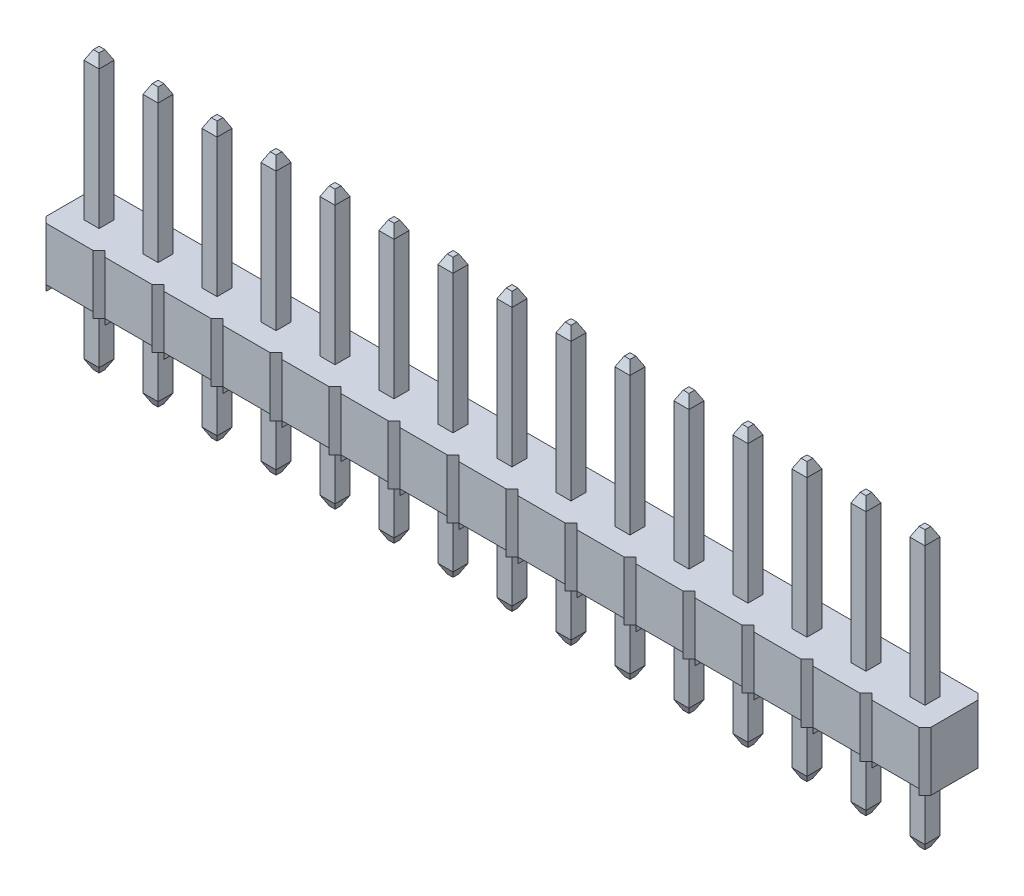
from build123d import *
from OCP.BRepFilletAPI import BRepFilletAPI_MakeChamfer

# Parameters (mm, degrees)
BOSS_EXTRUDE1_START  = -2.286
BOSS_EXTRUDE1_DEPTH  = 2.54
SKETCH2_W            = 2.032
SKETCH2_H            = 2.54
CUT_EXTRUDE1_DEPTH   = 0.254
SKETCH3_W            = 2.032
SKETCH3_H            = 2.54
CUT_EXTRUDE2_DEPTH   = 0.254
SKETCH4_W            = 2.032
SKETCH4_H            = 2.54
CUT_EXTRUDE3_DEPTH   = 0.254
SKETCH5_W            = 2.032
SKETCH5_H            = 2.54
CUT_EXTRUDE4_DEPTH   = 0.254
SKETCH6_W            = 2.032
SKETCH6_H            = 2.54
CUT_EXTRUDE5_DEPTH   = 0.254
SKETCH7_W            = 2.032
SKETCH7_H            = 2.54
CUT_EXTRUDE6_DEPTH   = 0.254
SKETCH8_W            = 2.032
SKETCH8_H            = 2.54
CUT_EXTRUDE7_DEPTH   = 0.254
SKETCH9_W            = 2.032
SKETCH9_H            = 2.54
CUT_EXTRUDE8_DEPTH   = 0.254
SKETCH10_W           = 2.032
SKETCH10_H           = 2.54
CUT_EXTRUDE9_DEPTH   = 0.254
SKETCH11_W           = 2.032
SKETCH11_H           = 2.54
CUT_EXTRUDE10_DEPTH  = 0.254
SKETCH12_W           = 2.032
SKETCH12_H           = 2.54
CUT_EXTRUDE11_DEPTH  = 0.254
SKETCH13_W           = 2.032
SKETCH13_H           = 2.54
CUT_EXTRUDE12_DEPTH  = 0.254
SKETCH14_W           = 2.032
SKETCH14_H           = 2.54
CUT_EXTRUDE13_DEPTH  = 0.254
CUT_EXTRUDE14_DEPTH  = 0.254
CUT_EXTRUDE15_DEPTH  = 0.254
BOSS_EXTRUDE2_DEPTH  = 0.254
BOSS_EXTRUDE3_DEPTH  = 0.254
SKETCH19_W           = 0.65
SKETCH19_H           = 0.65
BOSS_EXTRUDE4_DEPTH  = 3.302
SKETCH20_W           = 0.65
SKETCH20_H           = 0.65
BOSS_EXTRUDE5_DEPTH  = 3.302
SKETCH21_W           = 0.65
SKETCH21_H           = 0.65
BOSS_EXTRUDE6_DEPTH  = 3.302
SKETCH22_W           = 0.65
SKETCH22_H           = 0.65
BOSS_EXTRUDE7_DEPTH  = 3.302
SKETCH23_W           = 0.65
SKETCH23_H           = 0.65
BOSS_EXTRUDE8_DEPTH  = 3.302
SKETCH24_W           = 0.65
SKETCH24_H           = 0.65
BOSS_EXTRUDE9_DEPTH  = 3.302
SKETCH25_W           = 0.65
SKETCH25_H           = 0.65
BOSS_EXTRUDE10_DEPTH = 3.302
SKETCH26_W           = 0.65
SKETCH26_H           = 0.65
BOSS_EXTRUDE11_DEPTH = 3.302
SKETCH27_W           = 0.65
SKETCH27_H           = 0.65
BOSS_EXTRUDE12_DEPTH = 3.302
SKETCH28_W           = 0.65
SKETCH28_H           = 0.65
BOSS_EXTRUDE13_DEPTH = 3.302
SKETCH29_W           = 0.65
SKETCH29_H           = 0.65
BOSS_EXTRUDE14_DEPTH = 3.302
SKETCH30_W           = 0.65
SKETCH30_H           = 0.65
BOSS_EXTRUDE15_DEPTH = 3.302
SKETCH31_W           = 0.65
SKETCH31_H           = 0.65
BOSS_EXTRUDE16_DEPTH = 3.302
SKETCH32_W           = 0.65
SKETCH32_H           = 0.65
BOSS_EXTRUDE17_DEPTH = 3.302
SKETCH33_W           = 0.65
SKETCH33_H           = 0.65
BOSS_EXTRUDE18_DEPTH = 3.302
SKETCH34_W           = 0.65
SKETCH34_H           = 0.65
BOSS_EXTRUDE19_DEPTH = 6.35
SKETCH35_W           = 0.65
SKETCH35_H           = 0.65
BOSS_EXTRUDE20_DEPTH = 6.35
SKETCH36_W           = 0.65
SKETCH36_H           = 0.65
BOSS_EXTRUDE21_DEPTH = 6.35
SKETCH37_W           = 0.65
SKETCH37_H           = 0.65
BOSS_EXTRUDE22_DEPTH = 6.35
SKETCH38_W           = 0.65
SKETCH38_H           = 0.65
BOSS_EXTRUDE23_DEPTH = 6.35
SKETCH39_W           = 0.65
SKETCH39_H           = 0.65
BOSS_EXTRUDE24_DEPTH = 6.35
SKETCH40_W           = 0.65
SKETCH40_H           = 0.65
BOSS_EXTRUDE25_DEPTH = 6.35
SKETCH41_W           = 0.65
SKETCH41_H           = 0.65
BOSS_EXTRUDE26_DEPTH = 6.35
SKETCH42_W           = 0.65
SKETCH42_H           = 0.65
BOSS_EXTRUDE27_DEPTH = 6.35
SKETCH43_W           = 0.65
SKETCH43_H           = 0.65
BOSS_EXTRUDE28_DEPTH = 6.35
SKETCH44_W           = 0.65
SKETCH44_H           = 0.65
BOSS_EXTRUDE29_DEPTH = 6.35
SKETCH45_W           = 0.65
SKETCH45_H           = 0.65
BOSS_EXTRUDE30_DEPTH = 6.35
SKETCH46_W           = 0.65
SKETCH46_H           = 0.65
BOSS_EXTRUDE31_DEPTH = 6.35
SKETCH47_W           = 0.65
SKETCH47_H           = 0.65
BOSS_EXTRUDE32_DEPTH = 6.35
SKETCH48_W           = 0.65
SKETCH48_H           = 0.65
BOSS_EXTRUDE33_DEPTH = 6.35
CHAMFER1_SIZE        = 0.254
CHAMFER2_SIZE        = 0.2
CHAMFER2_SIZE2       = 0.4


with BuildPart() as part:
    # Boss-Extrude1: read off the stored shape, not the designer's step
    # Boss-Extrude1 outline → Boss-Extrude1 (new body)
    with BuildSketch(Plane.XZ.offset(-0.254).offset(BOSS_EXTRUDE1_START)):
        Polygon((31.496, -1.27), (31.75, -1.016), (32.004, -1.27), (34.036, -1.27), (34.29, -1.016), (34.544, -1.27), (36.576, -1.27), (36.83, -1.016), (36.83, 1.27), (34.544, 1.27), (34.29, 1.016), (34.036, 1.27), (32.004, 1.27), (31.75, 1.016), (31.496, 1.27), (29.464, 1.27), (29.21, 1.016), (28.956, 1.27), (26.924, 1.27), (26.67, 1.016), (26.416, 1.27), (24.384, 1.27), (24.13, 1.016), (23.876, 1.27), (21.844, 1.27), (21.59, 1.016), (21.336, 1.27), (19.304, 1.27), (19.05, 1.016), (18.796, 1.27), (16.764, 1.27), (16.51, 1.016), (16.256, 1.27), (14.224, 1.27), (13.97, 1.016), (13.716, 1.27), (11.684, 1.27), (11.43, 1.016), (11.176, 1.27), (9.144, 1.27), (8.89, 1.016), (8.636, 1.27), (6.604, 1.27), (6.35, 1.016), (6.096, 1.27), (4.064, 1.27), (3.81, 1.016), (3.556, 1.27), (1.524, 1.27), (1.27, 1.016), (1.016, 1.27), (-1.016, 1.27), (-1.27, 1.016), (-1.27, -1.27), (1.016, -1.27), (1.27, -1.016), (1.524, -1.27), (3.556, -1.27), (3.81, -1.016), (4.064, -1.27), (6.096, -1.27), (6.35, -1.016), (6.604, -1.27), (8.636, -1.27), (8.89, -1.016), (9.144, -1.27), (11.176, -1.27), (11.43, -1.016), (11.684, -1.27), (13.716, -1.27), (13.97, -1.016), (14.224, -1.27), (16.256, -1.27), (16.51, -1.016), (16.764, -1.27), (18.796, -1.27), (19.05, -1.016), (19.304, -1.27), (21.336, -1.27), (21.59, -1.016), (21.844, -1.27), (23.876, -1.27), (24.13, -1.016), (24.384, -1.27), (26.416, -1.27), (26.67, -1.016), (26.924, -1.27), (28.956, -1.27), (29.21, -1.016), (29.464, -1.27), align=None)
    extrude(amount=BOSS_EXTRUDE1_DEPTH)

    # Sketch2 → Cut-Extrude1 (cut)
    with BuildSketch(Plane.XZ):
        with Locations((17.78, 0)):
            Rectangle(SKETCH2_W, SKETCH2_H)
    extrude(amount=-CUT_EXTRUDE1_DEPTH, mode=Mode.SUBTRACT)

    # Sketch3 → Cut-Extrude2 (cut)
    with BuildSketch(Plane.XZ):
        with Locations((15.24, 0)):
            Rectangle(SKETCH3_W, SKETCH3_H)
    extrude(amount=-CUT_EXTRUDE2_DEPTH, mode=Mode.SUBTRACT)

    # Sketch4 → Cut-Extrude3 (cut)
    with BuildSketch(Plane.XZ):
        with Locations((20.32, 0)):
            Rectangle(SKETCH4_W, SKETCH4_H)
    extrude(amount=-CUT_EXTRUDE3_DEPTH, mode=Mode.SUBTRACT)

    # Sketch5 → Cut-Extrude4 (cut)
    with BuildSketch(Plane.XZ):
        with Locations((12.7, 0)):
            Rectangle(SKETCH5_W, SKETCH5_H)
    extrude(amount=-CUT_EXTRUDE4_DEPTH, mode=Mode.SUBTRACT)

    # Sketch6 → Cut-Extrude5 (cut)
    with BuildSketch(Plane.XZ):
        with Locations((22.86, 0)):
            Rectangle(SKETCH6_W, SKETCH6_H)
    extrude(amount=-CUT_EXTRUDE5_DEPTH, mode=Mode.SUBTRACT)

    # Sketch7 → Cut-Extrude6 (cut)
    with BuildSketch(Plane.XZ):
        with Locations((10.16, 0)):
            Rectangle(SKETCH7_W, SKETCH7_H)
    extrude(amount=-CUT_EXTRUDE6_DEPTH, mode=Mode.SUBTRACT)

    # Sketch8 → Cut-Extrude7 (cut)
    with BuildSketch(Plane.XZ):
        with Locations((25.4, 0)):
            Rectangle(SKETCH8_W, SKETCH8_H)
    extrude(amount=-CUT_EXTRUDE7_DEPTH, mode=Mode.SUBTRACT)

    # Sketch9 → Cut-Extrude8 (cut)
    with BuildSketch(Plane.XZ):
        with Locations((7.62, 0)):
            Rectangle(SKETCH9_W, SKETCH9_H)
    extrude(amount=-CUT_EXTRUDE8_DEPTH, mode=Mode.SUBTRACT)

    # Sketch10 → Cut-Extrude9 (cut)
    with BuildSketch(Plane.XZ):
        with Locations((27.94, 0)):
            Rectangle(SKETCH10_W, SKETCH10_H)
    extrude(amount=-CUT_EXTRUDE9_DEPTH, mode=Mode.SUBTRACT)

    # Sketch11 → Cut-Extrude10 (cut)
    with BuildSketch(Plane.XZ):
        with Locations((5.08, 0)):
            Rectangle(SKETCH11_W, SKETCH11_H)
    extrude(amount=-CUT_EXTRUDE10_DEPTH, mode=Mode.SUBTRACT)

    # Sketch12 → Cut-Extrude11 (cut)
    with BuildSketch(Plane.XZ):
        with Locations((30.48, 0)):
            Rectangle(SKETCH12_W, SKETCH12_H)
    extrude(amount=-CUT_EXTRUDE11_DEPTH, mode=Mode.SUBTRACT)

    # Sketch13 → Cut-Extrude12 (cut)
    with BuildSketch(Plane.XZ):
        with Locations((2.54, 0)):
            Rectangle(SKETCH13_W, SKETCH13_H)
    extrude(amount=-CUT_EXTRUDE12_DEPTH, mode=Mode.SUBTRACT)

    # Sketch14 → Cut-Extrude13 (cut)
    with BuildSketch(Plane.XZ):
        with Locations((33.02, 0)):
            Rectangle(SKETCH14_W, SKETCH14_H)
    extrude(amount=-CUT_EXTRUDE13_DEPTH, mode=Mode.SUBTRACT)

    # Sketch15 → Cut-Extrude14 (cut)
    with BuildSketch(Plane.XZ):
        Polygon((-1.27, -1.27), (1.016, -1.27), (1.016, 1.27), (-1.016, 1.27), (-1.27, 1.016), align=None)
    extrude(amount=-CUT_EXTRUDE14_DEPTH, mode=Mode.SUBTRACT)

    # Sketch16 → Cut-Extrude15 (cut)
    with BuildSketch(Plane.XZ):
        Polygon((34.544, -1.27), (36.576, -1.27), (36.83, -1.016), (36.83, 1.27), (34.544, 1.27), align=None)
    extrude(amount=-CUT_EXTRUDE15_DEPTH, mode=Mode.SUBTRACT)

    # Sketch17 → Boss-Extrude2 (add)
    with BuildSketch(Plane.XZ.offset(-0.254)):
        Polygon((-1.27, -1.27), (-1.27, 1.016), (-1.016, 1.27), (-1.016, -1.27), align=None)
    extrude(amount=BOSS_EXTRUDE2_DEPTH)

    # Sketch18 → Boss-Extrude3 (add)
    with BuildSketch(Plane.XZ.offset(-0.254)):
        Polygon((36.83, 1.27), (36.83, -1.016), (36.576, -1.27), (36.576, 1.27), align=None)
    extrude(amount=BOSS_EXTRUDE3_DEPTH)

    # Sketch19 → Boss-Extrude4 (add)
    with BuildSketch(Plane.XZ.offset(-0.254)):
        Rectangle(SKETCH19_W, SKETCH19_H)
    extrude(amount=BOSS_EXTRUDE4_DEPTH)

    # Sketch20 → Boss-Extrude5 (add)
    with BuildSketch(Plane.XZ.offset(-0.254)):
        with Locations((2.54, 0)):
            Rectangle(SKETCH20_W, SKETCH20_H)
    extrude(amount=BOSS_EXTRUDE5_DEPTH)

    # Sketch21 → Boss-Extrude6 (add)
    with BuildSketch(Plane.XZ.offset(-0.254)):
        with Locations((5.08, 0)):
            Rectangle(SKETCH21_W, SKETCH21_H)
    extrude(amount=BOSS_EXTRUDE6_DEPTH)

    # Sketch22 → Boss-Extrude7 (add)
    with BuildSketch(Plane.XZ.offset(-0.254)):
        with Locations((7.62, 0)):
            Rectangle(SKETCH22_W, SKETCH22_H)
    extrude(amount=BOSS_EXTRUDE7_DEPTH)

    # Sketch23 → Boss-Extrude8 (add)
    with BuildSketch(Plane.XZ.offset(-0.254)):
        with Locations((10.16, 0)):
            Rectangle(SKETCH23_W, SKETCH23_H)
    extrude(amount=BOSS_EXTRUDE8_DEPTH)

    # Sketch24 → Boss-Extrude9 (add)
    with BuildSketch(Plane.XZ.offset(-0.254)):
        with Locations((12.7, 0)):
            Rectangle(SKETCH24_W, SKETCH24_H)
    extrude(amount=BOSS_EXTRUDE9_DEPTH)

    # Sketch25 → Boss-Extrude10 (add)
    with BuildSketch(Plane.XZ.offset(-0.254)):
        with Locations((15.24, 0)):
            Rectangle(SKETCH25_W, SKETCH25_H)
    extrude(amount=BOSS_EXTRUDE10_DEPTH)

    # Sketch26 → Boss-Extrude11 (add)
    with BuildSketch(Plane.XZ.offset(-0.254)):
        with Locations((17.78, 0)):
            Rectangle(SKETCH26_W, SKETCH26_H)
    extrude(amount=BOSS_EXTRUDE11_DEPTH)

    # Sketch27 → Boss-Extrude12 (add)
    with BuildSketch(Plane.XZ.offset(-0.254)):
        with Locations((20.32, 0)):
            Rectangle(SKETCH27_W, SKETCH27_H)
    extrude(amount=BOSS_EXTRUDE12_DEPTH)

    # Sketch28 → Boss-Extrude13 (add)
    with BuildSketch(Plane.XZ.offset(-0.254)):
        with Locations((22.86, 0)):
            Rectangle(SKETCH28_W, SKETCH28_H)
    extrude(amount=BOSS_EXTRUDE13_DEPTH)

    # Sketch29 → Boss-Extrude14 (add)
    with BuildSketch(Plane.XZ.offset(-0.254)):
        with Locations((25.4, 0)):
            Rectangle(SKETCH29_W, SKETCH29_H)
    extrude(amount=BOSS_EXTRUDE14_DEPTH)

    # Sketch30 → Boss-Extrude15 (add)
    with BuildSketch(Plane.XZ.offset(-0.254)):
        with Locations((27.94, 0)):
            Rectangle(SKETCH30_W, SKETCH30_H)
    extrude(amount=BOSS_EXTRUDE15_DEPTH)

    # Sketch31 → Boss-Extrude16 (add)
    with BuildSketch(Plane.XZ.offset(-0.254)):
        with Locations((30.48, 0)):
            Rectangle(SKETCH31_W, SKETCH31_H)
    extrude(amount=BOSS_EXTRUDE16_DEPTH)

    # Sketch32 → Boss-Extrude17 (add)
    with BuildSketch(Plane.XZ.offset(-0.254)):
        with Locations((33.02, 0)):
            Rectangle(SKETCH32_W, SKETCH32_H)
    extrude(amount=BOSS_EXTRUDE17_DEPTH)

    # Sketch33 → Boss-Extrude18 (add)
    with BuildSketch(Plane.XZ.offset(-0.254)):
        with Locations((35.56, 0)):
            Rectangle(SKETCH33_W, SKETCH33_H)
    extrude(amount=BOSS_EXTRUDE18_DEPTH)

    # Sketch34 → Boss-Extrude19 (add)
    with BuildSketch(Plane(origin=(0, 2.54, 0), x_dir=(-1, 0, 0), z_dir=(0, 1, 0))):
        Rectangle(SKETCH34_W, SKETCH34_H)
    extrude(amount=BOSS_EXTRUDE19_DEPTH)

    # Sketch35 → Boss-Extrude20 (add)
    with BuildSketch(Plane(origin=(0, 2.54, 0), x_dir=(-1, 0, 0), z_dir=(0, 1, 0))):
        with Locations((-2.54, 0)):
            Rectangle(SKETCH35_W, SKETCH35_H)
    extrude(amount=BOSS_EXTRUDE20_DEPTH)

    # Sketch36 → Boss-Extrude21 (add)
    with BuildSketch(Plane(origin=(0, 2.54, 0), x_dir=(-1, 0, 0), z_dir=(0, 1, 0))):
        with Locations((-5.08, 0)):
            Rectangle(SKETCH36_W, SKETCH36_H)
    extrude(amount=BOSS_EXTRUDE21_DEPTH)

    # Sketch37 → Boss-Extrude22 (add)
    with BuildSketch(Plane(origin=(0, 2.54, 0), x_dir=(-1, 0, 0), z_dir=(0, 1, 0))):
        with Locations((-7.62, 0)):
            Rectangle(SKETCH37_W, SKETCH37_H)
    extrude(amount=BOSS_EXTRUDE22_DEPTH)

    # Sketch38 → Boss-Extrude23 (add)
    with BuildSketch(Plane(origin=(0, 2.54, 0), x_dir=(-1, 0, 0), z_dir=(0, 1, 0))):
        with Locations((-10.16, 0)):
            Rectangle(SKETCH38_W, SKETCH38_H)
    extrude(amount=BOSS_EXTRUDE23_DEPTH)

    # Sketch39 → Boss-Extrude24 (add)
    with BuildSketch(Plane(origin=(0, 2.54, 0), x_dir=(-1, 0, 0), z_dir=(0, 1, 0))):
        with Locations((-12.7, 0)):
            Rectangle(SKETCH39_W, SKETCH39_H)
    extrude(amount=BOSS_EXTRUDE24_DEPTH)

    # Sketch40 → Boss-Extrude25 (add)
    with BuildSketch(Plane(origin=(0, 2.54, 0), x_dir=(-1, 0, 0), z_dir=(0, 1, 0))):
        with Locations((-15.24, 0)):
            Rectangle(SKETCH40_W, SKETCH40_H)
    extrude(amount=BOSS_EXTRUDE25_DEPTH)

    # Sketch41 → Boss-Extrude26 (add)
    with BuildSketch(Plane(origin=(0, 2.54, 0), x_dir=(-1, 0, 0), z_dir=(0, 1, 0))):
        with Locations((-17.78, 0)):
            Rectangle(SKETCH41_W, SKETCH41_H)
    extrude(amount=BOSS_EXTRUDE26_DEPTH)

    # Sketch42 → Boss-Extrude27 (add)
    with BuildSketch(Plane(origin=(0, 2.54, 0), x_dir=(-1, 0, 0), z_dir=(0, 1, 0))):
        with Locations((-20.32, 0)):
            Rectangle(SKETCH42_W, SKETCH42_H)
    extrude(amount=BOSS_EXTRUDE27_DEPTH)

    # Sketch43 → Boss-Extrude28 (add)
    with BuildSketch(Plane(origin=(0, 2.54, 0), x_dir=(-1, 0, 0), z_dir=(0, 1, 0))):
        with Locations((-22.86, 0)):
            Rectangle(SKETCH43_W, SKETCH43_H)
    extrude(amount=BOSS_EXTRUDE28_DEPTH)

    # Sketch44 → Boss-Extrude29 (add)
    with BuildSketch(Plane(origin=(0, 2.54, 0), x_dir=(-1, 0, 0), z_dir=(0, 1, 0))):
        with Locations((-25.4, 0)):
            Rectangle(SKETCH44_W, SKETCH44_H)
    extrude(amount=BOSS_EXTRUDE29_DEPTH)

    # Sketch45 → Boss-Extrude30 (add)
    with BuildSketch(Plane(origin=(0, 2.54, 0), x_dir=(-1, 0, 0), z_dir=(0, 1, 0))):
        with Locations((-27.94, 0)):
            Rectangle(SKETCH45_W, SKETCH45_H)
    extrude(amount=BOSS_EXTRUDE30_DEPTH)

    # Sketch46 → Boss-Extrude31 (add)
    with BuildSketch(Plane(origin=(0, 2.54, 0), x_dir=(-1, 0, 0), z_dir=(0, 1, 0))):
        with Locations((-30.48, 0)):
            Rectangle(SKETCH46_W, SKETCH46_H)
    extrude(amount=BOSS_EXTRUDE31_DEPTH)

    # Sketch47 → Boss-Extrude32 (add)
    with BuildSketch(Plane(origin=(0, 2.54, 0), x_dir=(-1, 0, 0), z_dir=(0, 1, 0))):
        with Locations((-33.02, 0)):
            Rectangle(SKETCH47_W, SKETCH47_H)
    extrude(amount=BOSS_EXTRUDE32_DEPTH)

    # Sketch48 → Boss-Extrude33 (add)
    with BuildSketch(Plane(origin=(0, 2.54, 0), x_dir=(-1, 0, 0), z_dir=(0, 1, 0))):
        with Locations((-35.56, 0)):
            Rectangle(SKETCH48_W, SKETCH48_H)
    extrude(amount=BOSS_EXTRUDE33_DEPTH)

    # Chamfer1
    chamfer1_edges = [part.edges().sort_by_distance(p)[0] for p in [
        (36.83, 1.27, 1.27),
        (-1.27, 1.27, -1.27),
    ]]
    chamfer(chamfer1_edges, length=CHAMFER1_SIZE)

    # Chamfer2: one chamfer whose edges measure the first distance from different faces: ONE call of the kernel's chamfer builder (chamfer() names one face for all edges)
    chamfer2_edges_1 = [part.edges().sort_by_distance(p)[0] for p in [
        (-0.325, -3.048, 0),
        (0, -3.048, -0.325),
        (0.325, -3.048, 0),
        (0, -3.048, 0.325),
    ]]
    chamfer2_side_1 = [part.faces().sort_by_distance(p)[0] for p in [
        (0, -3.048, 0),
    ]]
    chamfer2_edges_2 = [part.edges().sort_by_distance(p)[0] for p in [
        (2.54, -3.048, -0.325),
        (2.865, -3.048, 0),
        (2.54, -3.048, 0.325),
        (2.215, -3.048, 0),
    ]]
    chamfer2_side_2 = [part.faces().sort_by_distance(p)[0] for p in [
        (2.54, -3.048, 0),
    ]]
    chamfer2_edges_3 = [part.edges().sort_by_distance(p)[0] for p in [
        (5.08, -3.048, -0.325),
        (5.405, -3.048, 0),
        (5.08, -3.048, 0.325),
        (4.755, -3.048, 0),
    ]]
    chamfer2_side_3 = [part.faces().sort_by_distance(p)[0] for p in [
        (5.08, -3.048, 0),
    ]]
    chamfer2_edges_4 = [part.edges().sort_by_distance(p)[0] for p in [
        (7.62, -3.048, -0.325),
        (7.945, -3.048, 0),
        (7.62, -3.048, 0.325),
        (7.295, -3.048, 0),
    ]]
    chamfer2_side_4 = [part.faces().sort_by_distance(p)[0] for p in [
        (7.62, -3.048, 0),
    ]]
    chamfer2_edges_5 = [part.edges().sort_by_distance(p)[0] for p in [
        (10.16, -3.048, -0.325),
        (10.485, -3.048, 0),
        (10.16, -3.048, 0.325),
        (9.835, -3.048, 0),
    ]]
    chamfer2_side_5 = [part.faces().sort_by_distance(p)[0] for p in [
        (10.16, -3.048, 0),
    ]]
    chamfer2_edges_6 = [part.edges().sort_by_distance(p)[0] for p in [
        (12.7, -3.048, -0.325),
        (13.025, -3.048, 0),
        (12.7, -3.048, 0.325),
        (12.375, -3.048, 0),
    ]]
    chamfer2_side_6 = [part.faces().sort_by_distance(p)[0] for p in [
        (12.7, -3.048, 0),
    ]]
    chamfer2_edges_7 = [part.edges().sort_by_distance(p)[0] for p in [
        (15.24, -3.048, -0.325),
        (15.565, -3.048, 0),
        (15.24, -3.048, 0.325),
        (14.915, -3.048, 0),
    ]]
    chamfer2_side_7 = [part.faces().sort_by_distance(p)[0] for p in [
        (15.24, -3.048, 0),
    ]]
    chamfer2_edges_8 = [part.edges().sort_by_distance(p)[0] for p in [
        (17.78, -3.048, -0.325),
        (18.105, -3.048, 0),
        (17.78, -3.048, 0.325),
        (17.455, -3.048, 0),
    ]]
    chamfer2_side_8 = [part.faces().sort_by_distance(p)[0] for p in [
        (17.78, -3.048, 0),
    ]]
    chamfer2_edges_9 = [part.edges().sort_by_distance(p)[0] for p in [
        (20.32, -3.048, -0.325),
        (20.645, -3.048, 0),
        (20.32, -3.048, 0.325),
        (19.995, -3.048, 0),
    ]]
    chamfer2_side_9 = [part.faces().sort_by_distance(p)[0] for p in [
        (20.32, -3.048, 0),
    ]]
    chamfer2_edges_10 = [part.edges().sort_by_distance(p)[0] for p in [
        (22.86, -3.048, -0.325),
        (23.185, -3.048, 0),
        (22.86, -3.048, 0.325),
        (22.535, -3.048, 0),
    ]]
    chamfer2_side_10 = [part.faces().sort_by_distance(p)[0] for p in [
        (22.86, -3.048, 0),
    ]]
    chamfer2_edges_11 = [part.edges().sort_by_distance(p)[0] for p in [
        (25.4, -3.048, -0.325),
        (25.725, -3.048, 0),
        (25.4, -3.048, 0.325),
        (25.075, -3.048, 0),
    ]]
    chamfer2_side_11 = [part.faces().sort_by_distance(p)[0] for p in [
        (25.4, -3.048, 0),
    ]]
    chamfer2_edges_12 = [part.edges().sort_by_distance(p)[0] for p in [
        (27.94, -3.048, -0.325),
        (28.265, -3.048, 0),
        (27.94, -3.048, 0.325),
        (27.615, -3.048, 0),
    ]]
    chamfer2_side_12 = [part.faces().sort_by_distance(p)[0] for p in [
        (27.94, -3.048, 0),
    ]]
    chamfer2_edges_13 = [part.edges().sort_by_distance(p)[0] for p in [
        (30.48, -3.048, -0.325),
        (30.805, -3.048, 0),
        (30.48, -3.048, 0.325),
        (30.155, -3.048, 0),
    ]]
    chamfer2_side_13 = [part.faces().sort_by_distance(p)[0] for p in [
        (30.48, -3.048, 0),
    ]]
    chamfer2_edges_14 = [part.edges().sort_by_distance(p)[0] for p in [
        (33.02, -3.048, -0.325),
        (33.345, -3.048, 0),
        (33.02, -3.048, 0.325),
        (32.695, -3.048, 0),
    ]]
    chamfer2_side_14 = [part.faces().sort_by_distance(p)[0] for p in [
        (33.02, -3.048, 0),
    ]]
    chamfer2_edges_15 = [part.edges().sort_by_distance(p)[0] for p in [
        (35.56, -3.048, -0.325),
        (35.885, -3.048, 0),
        (35.56, -3.048, 0.325),
        (35.235, -3.048, 0),
    ]]
    chamfer2_side_15 = [part.faces().sort_by_distance(p)[0] for p in [
        (35.56, -3.048, 0),
    ]]
    chamfer2_edges_16 = [part.edges().sort_by_distance(p)[0] for p in [
        (0, 8.89, 0.325),
        (0.325, 8.89, 0),
        (0, 8.89, -0.325),
        (-0.325, 8.89, 0),
    ]]
    chamfer2_side_16 = [part.faces().sort_by_distance(p)[0] for p in [
        (0, 8.89, 0),
    ]]
    chamfer2_edges_17 = [part.edges().sort_by_distance(p)[0] for p in [
        (2.54, 8.89, 0.325),
        (2.865, 8.89, 0),
        (2.54, 8.89, -0.325),
        (2.215, 8.89, 0),
    ]]
    chamfer2_side_17 = [part.faces().sort_by_distance(p)[0] for p in [
        (2.54, 8.89, 0),
    ]]
    chamfer2_edges_18 = [part.edges().sort_by_distance(p)[0] for p in [
        (5.08, 8.89, 0.325),
        (5.405, 8.89, 0),
        (5.08, 8.89, -0.325),
        (4.755, 8.89, 0),
    ]]
    chamfer2_side_18 = [part.faces().sort_by_distance(p)[0] for p in [
        (5.08, 8.89, 0),
    ]]
    chamfer2_edges_19 = [part.edges().sort_by_distance(p)[0] for p in [
        (7.945, 8.89, 0),
        (7.62, 8.89, -0.325),
        (7.295, 8.89, 0),
        (7.62, 8.89, 0.325),
    ]]
    chamfer2_side_19 = [part.faces().sort_by_distance(p)[0] for p in [
        (7.62, 8.89, 0),
    ]]
    chamfer2_edges_20 = [part.edges().sort_by_distance(p)[0] for p in [
        (10.16, 8.89, 0.325),
        (10.485, 8.89, 0),
        (10.16, 8.89, -0.325),
        (9.835, 8.89, 0),
    ]]
    chamfer2_side_20 = [part.faces().sort_by_distance(p)[0] for p in [
        (10.16, 8.89, 0),
    ]]
    chamfer2_edges_21 = [part.edges().sort_by_distance(p)[0] for p in [
        (13.025, 8.89, 0),
        (12.7, 8.89, -0.325),
        (12.375, 8.89, 0),
        (12.7, 8.89, 0.325),
    ]]
    chamfer2_side_21 = [part.faces().sort_by_distance(p)[0] for p in [
        (12.7, 8.89, 0),
    ]]
    chamfer2_edges_22 = [part.edges().sort_by_distance(p)[0] for p in [
        (15.24, 8.89, 0.325),
        (15.565, 8.89, 0),
        (15.24, 8.89, -0.325),
        (14.915, 8.89, 0),
    ]]
    chamfer2_side_22 = [part.faces().sort_by_distance(p)[0] for p in [
        (15.24, 8.89, 0),
    ]]
    chamfer2_edges_23 = [part.edges().sort_by_distance(p)[0] for p in [
        (18.105, 8.89, 0),
        (17.78, 8.89, -0.325),
        (17.455, 8.89, 0),
        (17.78, 8.89, 0.325),
    ]]
    chamfer2_side_23 = [part.faces().sort_by_distance(p)[0] for p in [
        (17.78, 8.89, 0),
    ]]
    chamfer2_edges_24 = [part.edges().sort_by_distance(p)[0] for p in [
        (20.32, 8.89, 0.325),
        (20.645, 8.89, 0),
        (20.32, 8.89, -0.325),
        (19.995, 8.89, 0),
    ]]
    chamfer2_side_24 = [part.faces().sort_by_distance(p)[0] for p in [
        (20.32, 8.89, 0),
    ]]
    chamfer2_edges_25 = [part.edges().sort_by_distance(p)[0] for p in [
        (23.185, 8.89, 0),
        (22.86, 8.89, -0.325),
        (22.535, 8.89, 0),
        (22.86, 8.89, 0.325),
    ]]
    chamfer2_side_25 = [part.faces().sort_by_distance(p)[0] for p in [
        (22.86, 8.89, 0),
    ]]
    chamfer2_edges_26 = [part.edges().sort_by_distance(p)[0] for p in [
        (25.4, 8.89, 0.325),
        (25.725, 8.89, 0),
        (25.4, 8.89, -0.325),
        (25.075, 8.89, 0),
    ]]
    chamfer2_side_26 = [part.faces().sort_by_distance(p)[0] for p in [
        (25.4, 8.89, 0),
    ]]
    chamfer2_edges_27 = [part.edges().sort_by_distance(p)[0] for p in [
        (28.265, 8.89, 0),
        (27.94, 8.89, -0.325),
        (27.615, 8.89, 0),
        (27.94, 8.89, 0.325),
    ]]
    chamfer2_side_27 = [part.faces().sort_by_distance(p)[0] for p in [
        (27.94, 8.89, 0),
    ]]
    chamfer2_edges_28 = [part.edges().sort_by_distance(p)[0] for p in [
        (30.48, 8.89, 0.325),
        (30.805, 8.89, 0),
        (30.48, 8.89, -0.325),
        (30.155, 8.89, 0),
    ]]
    chamfer2_side_28 = [part.faces().sort_by_distance(p)[0] for p in [
        (30.48, 8.89, 0),
    ]]
    chamfer2_edges_29 = [part.edges().sort_by_distance(p)[0] for p in [
        (33.345, 8.89, 0),
        (33.02, 8.89, -0.325),
        (32.695, 8.89, 0),
        (33.02, 8.89, 0.325),
    ]]
    chamfer2_side_29 = [part.faces().sort_by_distance(p)[0] for p in [
        (33.02, 8.89, 0),
    ]]
    chamfer2_edges_30 = [part.edges().sort_by_distance(p)[0] for p in [
        (35.56, 8.89, 0.325),
        (35.885, 8.89, 0),
        (35.56, 8.89, -0.325),
        (35.235, 8.89, 0),
    ]]
    chamfer2_side_30 = [part.faces().sort_by_distance(p)[0] for p in [
        (35.56, 8.89, 0),
    ]]
    chamfer2 = BRepFilletAPI_MakeChamfer(part.part.solid().wrapped)
    for e in chamfer2_edges_1:
        chamfer2.Add(CHAMFER2_SIZE, CHAMFER2_SIZE2, e.wrapped, chamfer2_side_1[0].wrapped)  # the first distance lies on this face
    for e in chamfer2_edges_2:
        chamfer2.Add(CHAMFER2_SIZE, CHAMFER2_SIZE2, e.wrapped, chamfer2_side_2[0].wrapped)  # the first distance lies on this face
    for e in chamfer2_edges_3:
        chamfer2.Add(CHAMFER2_SIZE, CHAMFER2_SIZE2, e.wrapped, chamfer2_side_3[0].wrapped)  # the first distance lies on this face
    for e in chamfer2_edges_4:
        chamfer2.Add(CHAMFER2_SIZE, CHAMFER2_SIZE2, e.wrapped, chamfer2_side_4[0].wrapped)  # the first distance lies on this face
    for e in chamfer2_edges_5:
        chamfer2.Add(CHAMFER2_SIZE, CHAMFER2_SIZE2, e.wrapped, chamfer2_side_5[0].wrapped)  # the first distance lies on this face
    for e in chamfer2_edges_6:
        chamfer2.Add(CHAMFER2_SIZE, CHAMFER2_SIZE2, e.wrapped, chamfer2_side_6[0].wrapped)  # the first distance lies on this face
    for e in chamfer2_edges_7:
        chamfer2.Add(CHAMFER2_SIZE, CHAMFER2_SIZE2, e.wrapped, chamfer2_side_7[0].wrapped)  # the first distance lies on this face
    for e in chamfer2_edges_8:
        chamfer2.Add(CHAMFER2_SIZE, CHAMFER2_SIZE2, e.wrapped, chamfer2_side_8[0].wrapped)  # the first distance lies on this face
    for e in chamfer2_edges_9:
        chamfer2.Add(CHAMFER2_SIZE, CHAMFER2_SIZE2, e.wrapped, chamfer2_side_9[0].wrapped)  # the first distance lies on this face
    for e in chamfer2_edges_10:
        chamfer2.Add(CHAMFER2_SIZE, CHAMFER2_SIZE2, e.wrapped, chamfer2_side_10[0].wrapped)  # the first distance lies on this face
    for e in chamfer2_edges_11:
        chamfer2.Add(CHAMFER2_SIZE, CHAMFER2_SIZE2, e.wrapped, chamfer2_side_11[0].wrapped)  # the first distance lies on this face
    for e in chamfer2_edges_12:
        chamfer2.Add(CHAMFER2_SIZE, CHAMFER2_SIZE2, e.wrapped, chamfer2_side_12[0].wrapped)  # the first distance lies on this face
    for e in chamfer2_edges_13:
        chamfer2.Add(CHAMFER2_SIZE, CHAMFER2_SIZE2, e.wrapped, chamfer2_side_13[0].wrapped)  # the first distance lies on this face
    for e in chamfer2_edges_14:
        chamfer2.Add(CHAMFER2_SIZE, CHAMFER2_SIZE2, e.wrapped, chamfer2_side_14[0].wrapped)  # the first distance lies on this face
    for e in chamfer2_edges_15:
        chamfer2.Add(CHAMFER2_SIZE, CHAMFER2_SIZE2, e.wrapped, chamfer2_side_15[0].wrapped)  # the first distance lies on this face
    for e in chamfer2_edges_16:
        chamfer2.Add(CHAMFER2_SIZE, CHAMFER2_SIZE2, e.wrapped, chamfer2_side_16[0].wrapped)  # the first distance lies on this face
    for e in chamfer2_edges_17:
        chamfer2.Add(CHAMFER2_SIZE, CHAMFER2_SIZE2, e.wrapped, chamfer2_side_17[0].wrapped)  # the first distance lies on this face
    for e in chamfer2_edges_18:
        chamfer2.Add(CHAMFER2_SIZE, CHAMFER2_SIZE2, e.wrapped, chamfer2_side_18[0].wrapped)  # the first distance lies on this face
    for e in chamfer2_edges_19:
        chamfer2.Add(CHAMFER2_SIZE, CHAMFER2_SIZE2, e.wrapped, chamfer2_side_19[0].wrapped)  # the first distance lies on this face
    for e in chamfer2_edges_20:
        chamfer2.Add(CHAMFER2_SIZE, CHAMFER2_SIZE2, e.wrapped, chamfer2_side_20[0].wrapped)  # the first distance lies on this face
    for e in chamfer2_edges_21:
        chamfer2.Add(CHAMFER2_SIZE, CHAMFER2_SIZE2, e.wrapped, chamfer2_side_21[0].wrapped)  # the first distance lies on this face
    for e in chamfer2_edges_22:
        chamfer2.Add(CHAMFER2_SIZE, CHAMFER2_SIZE2, e.wrapped, chamfer2_side_22[0].wrapped)  # the first distance lies on this face
    for e in chamfer2_edges_23:
        chamfer2.Add(CHAMFER2_SIZE, CHAMFER2_SIZE2, e.wrapped, chamfer2_side_23[0].wrapped)  # the first distance lies on this face
    for e in chamfer2_edges_24:
        chamfer2.Add(CHAMFER2_SIZE, CHAMFER2_SIZE2, e.wrapped, chamfer2_side_24[0].wrapped)  # the first distance lies on this face
    for e in chamfer2_edges_25:
        chamfer2.Add(CHAMFER2_SIZE, CHAMFER2_SIZE2, e.wrapped, chamfer2_side_25[0].wrapped)  # the first distance lies on this face
    for e in chamfer2_edges_26:
        chamfer2.Add(CHAMFER2_SIZE, CHAMFER2_SIZE2, e.wrapped, chamfer2_side_26[0].wrapped)  # the first distance lies on this face
    for e in chamfer2_edges_27:
        chamfer2.Add(CHAMFER2_SIZE, CHAMFER2_SIZE2, e.wrapped, chamfer2_side_27[0].wrapped)  # the first distance lies on this face
    for e in chamfer2_edges_28:
        chamfer2.Add(CHAMFER2_SIZE, CHAMFER2_SIZE2, e.wrapped, chamfer2_side_28[0].wrapped)  # the first distance lies on this face
    for e in chamfer2_edges_29:
        chamfer2.Add(CHAMFER2_SIZE, CHAMFER2_SIZE2, e.wrapped, chamfer2_side_29[0].wrapped)  # the first distance lies on this face
    for e in chamfer2_edges_30:
        chamfer2.Add(CHAMFER2_SIZE, CHAMFER2_SIZE2, e.wrapped, chamfer2_side_30[0].wrapped)  # the first distance lies on this face
    add(Compound.cast(chamfer2.Shape()), mode=Mode.REPLACE)


solid = part.part
